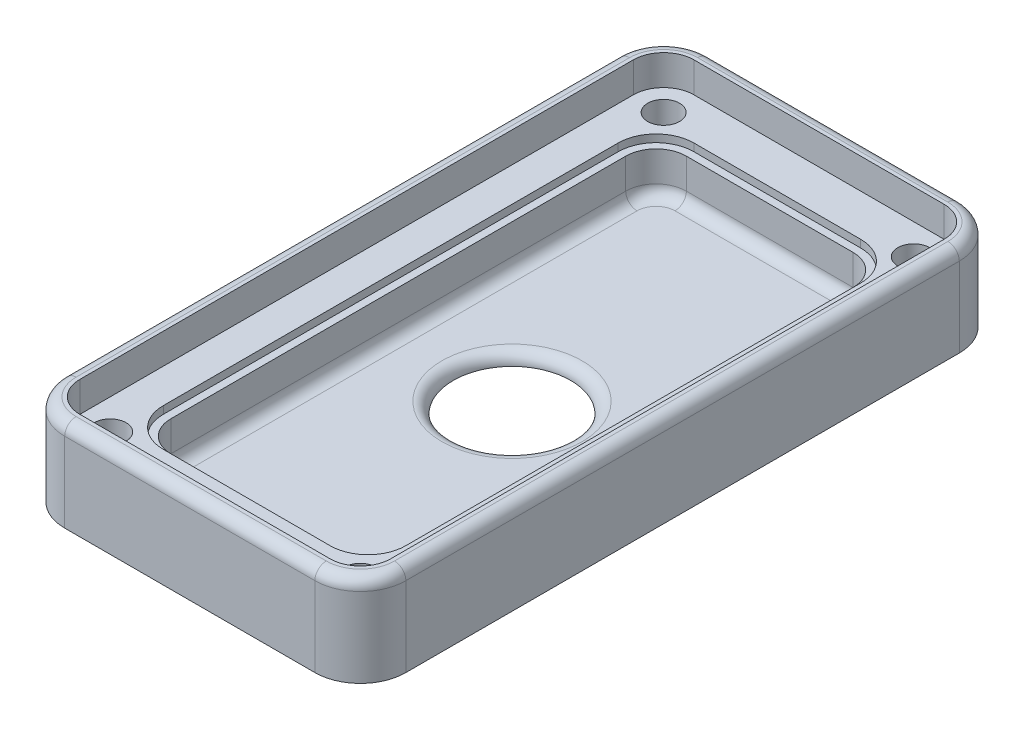
from build123d import *

# Parameters (mm, degrees)
BOSS_EXTRUDE1_DEPTH        = 12
CUT_EXTRUDE1_DEPTH         = 4
SKETCH3_R                  = 7.75
CUT_EXTRUDE2_DEPTH         = 50.563091106
CUT_EXTRUDE3_DEPTH         = 49.595267259
CUT_EXTRUDE4_DEPTH         = 50.221438419
F_4_2_4_2_DIAMETER_HOLE1_D = 4.2
FILLET1_R                  = 1.5
FILLET2_R                  = 1.5


with BuildPart() as part:
    # Sketch1 → Boss-Extrude1 (new body)
    with BuildSketch(Plane(origin=(0, 0, 0), x_dir=(1, 0, 0), z_dir=(0, 1, 0))):
        with BuildLine():
            Line((-16.5, -42.5), (16.5, -42.5))
            ThreePointArc((16.5, -42.5), (20.742640687, -40.742640687), (22.5, -36.5))
            Line((22.5, -36.5), (22.5, 36.5))
            ThreePointArc((22.5, 36.5), (20.742640687, 40.742640687), (16.5, 42.5))
            Line((16.5, 42.5), (-16.5, 42.5))
            ThreePointArc((-16.5, 42.5), (-20.742640687, 40.742640687), (-22.5, 36.5))
            Line((-22.5, 36.5), (-22.5, -36.5))
            ThreePointArc((-22.5, -36.5), (-20.742640687, -40.742640687), (-16.5, -42.5))
        make_face()
    extrude(amount=BOSS_EXTRUDE1_DEPTH)

    # Sketch2 → Cut-Extrude1 (cut)
    with BuildSketch(Plane(origin=(0, 12, 0), x_dir=(1, 0, 0), z_dir=(0, 1, 0))):
        with BuildLine():
            Line((-16.5, -40.5), (16.5, -40.5))
            ThreePointArc((16.5, -40.5), (19.328427125, -39.328427125), (20.5, -36.5))
            Line((20.5, -36.5), (20.5, 36.5))
            ThreePointArc((20.5, 36.5), (19.328427125, 39.328427125), (16.5, 40.5))
            Line((16.5, 40.5), (-16.5, 40.5))
            ThreePointArc((-16.5, 40.5), (-19.328427125, 39.328427125), (-20.5, 36.5))
            Line((-20.5, 36.5), (-20.5, -36.5))
            ThreePointArc((-20.5, -36.5), (-19.328427125, -39.328427125), (-16.5, -40.5))
        make_face()
    extrude(amount=-CUT_EXTRUDE1_DEPTH, mode=Mode.SUBTRACT)

    # Sketch3 → Cut-Extrude2 (cut, through all)
    with BuildSketch(Plane(origin=(0, 0, 0), x_dir=(1, 0, 0), z_dir=(0, 1, 0))):
        with Locations(Location((0, 0, 0), (0, 0, 270))):
            Circle(SKETCH3_R)
    extrude(amount=CUT_EXTRUDE2_DEPTH, mode=Mode.SUBTRACT)

    # Sketch4 → Cut-Extrude3 (cut, through all)
    with BuildSketch(Plane(origin=(0, 7, 0), x_dir=(1, 0, 0), z_dir=(0, 1, 0))):
        with BuildLine():
            Line((-16, -30), (-16, 30))
            ThreePointArc((-16, 30), (-14.535533906, 33.535533906), (-11, 35))
            Line((-11, 35), (11, 35))
            ThreePointArc((11, 35), (14.535533906, 33.535533906), (16, 30))
            Line((16, 30), (16, -30))
            ThreePointArc((16, -30), (14.535533906, -33.535533906), (11, -35))
            Line((11, -35), (-11, -35))
            ThreePointArc((-11, -35), (-14.535533906, -33.535533906), (-16, -30))
        make_face()
    extrude(amount=CUT_EXTRUDE3_DEPTH, mode=Mode.SUBTRACT)

    # Sketch6 → Cut-Extrude4 (cut, through all)
    with BuildSketch(Plane(origin=(0, 1.5, 0), x_dir=(1, 0, 0), z_dir=(0, 1, 0))):
        with BuildLine():
            Line((-11, -34), (11, -34))
            ThreePointArc((11, -34), (13.828427125, -32.828427125), (15, -30))
            Line((15, -30), (15, 30))
            ThreePointArc((15, 30), (13.828427125, 32.828427125), (11, 34))
            Line((11, 34), (-11, 34))
            ThreePointArc((-11, 34), (-13.828427125, 32.828427125), (-15, 30))
            Line((-15, 30), (-15, -30))
            ThreePointArc((-15, -30), (-13.828427125, -32.828427125), (-11, -34))
        make_face()
    extrude(amount=CUT_EXTRUDE4_DEPTH, mode=Mode.SUBTRACT)

    # Ø4.2 (4.2) Diameter Hole1 (through all)
    with Locations(Plane.XZ):
        with Locations((-16.5, 36.5), (16.5, 36.5), (16.5, -36.5), (-16.5, -36.5)):
            Hole(F_4_2_4_2_DIAMETER_HOLE1_D / 2)

    # Fillet1
    fillet1_edges = [part.edges().sort_by_distance(p)[0] for p in [
        (20.742640687, 12, 40.742640687),
        (22.5, 12, 0),
        (20.742640687, 12, -40.742640687),
        (0, 12, -42.5),
        (-20.742640687, 12, -40.742640687),
        (-22.5, 12, 0),
        (-20.742640687, 12, 40.742640687),
        (0, 12, 42.5),
    ]]
    fillet(fillet1_edges, radius=FILLET1_R)

    # Fillet2
    fillet2_edges = [part.edges().sort_by_distance(p)[0] for p in [
        (0, 1.5, -7.75),
        (-13.828427125, 1.5, 32.828427125),
        (0, 1.5, 34),
        (13.828427125, 1.5, 32.828427125),
        (15, 1.5, 0),
        (13.828427125, 1.5, -32.828427125),
        (0, 1.5, -34),
        (-13.828427125, 1.5, -32.828427125),
        (-15, 1.5, 0),
    ]]
    fillet(fillet2_edges, radius=FILLET2_R - 0.0001)  # a hair under: the kernel refuses the full size


solid = part.part
